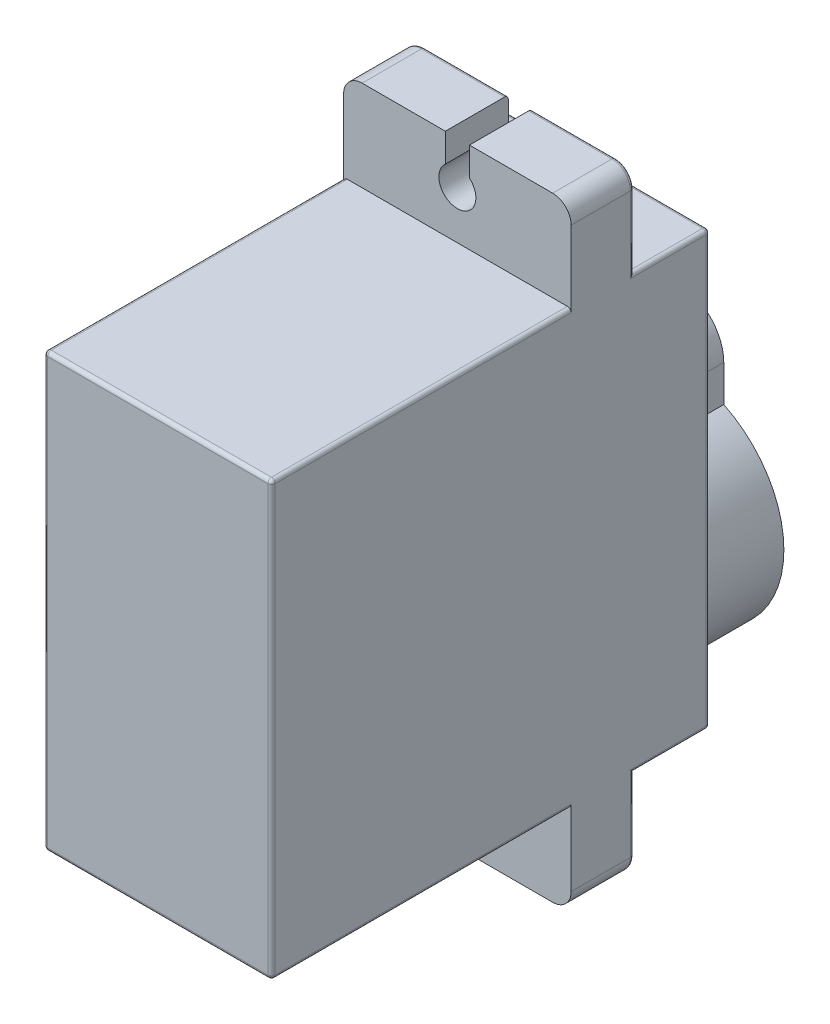
from build123d import *

# Parameters (mm, degrees)
DODANIE_WYCI_GNI_CIE1_DEPTH = 12.3
ZAOKR_GLENIE1_R             = 0.2
ZAOKR_GLENIE2_R             = 1
DODANIE_WYCI_GNI_CIE2_DEPTH = 4.4
SZKIC3_R                    = 2.45
WYTNIJ_WYCI_GNI_CIE1_DEPTH  = 3.2
WYTNIJ_WYCI_GNI_CIE2_REACH  = 38.556


with BuildPart() as part:
    # Szkic1 → Dodanie-wyciągnięcie1 (new body)
    with BuildSketch(Plane(origin=(0, 0, 0), x_dir=(0, 0, -1), z_dir=(1, 0, 0))):
        Polygon((0, 0), (0, 23.4), (16.2, 23.4), (16.2, 28.3), (19.6, 28.3), (19.6, 23.4), (23.7, 23.4), (23.7, 0), (19.6, 0), (19.6, -4.9), (16.2, -4.9), (16.2, 0), align=None)
    extrude(amount=DODANIE_WYCI_GNI_CIE1_DEPTH)

    # Zaokrąglenie1
    zaokr_glenie1_edges = [part.edges().sort_by_distance(p)[0] for p in [
        (0, 11.7, 0),
        (0, 23.4, -8.1),
        (0, 25.85, -19.6),
        (0, 23.4, -21.65),
        (0, 11.7, -23.7),
        (0, 0, -21.65),
        (0, -2.45, -19.6),
        (0, 0, -8.1),
        (12.3, -2.45, -19.6),
        (6.15, 0, 0),
        (6.15, 23.4, 0),
        (12.3, 0, -21.65),
        (6.15, 28.3, -19.6),
        (6.15, 23.4, -23.7),
        (6.15, 0, -23.7),
        (6.15, -4.9, -19.6),
        (12.3, 11.7, -23.7),
        (12.3, 23.4, -21.65),
        (12.3, 25.85, -19.6),
        (12.3, 23.4, -8.1),
        (12.3, 11.7, 0),
        (12.3, 0, -8.1),
    ]]
    fillet(zaokr_glenie1_edges, radius=ZAOKR_GLENIE1_R)

    # Zaokrąglenie2
    # the kernel refuses this fillet: 1 mm, written as the material it takes off along each edge
    with BuildSketch(Plane(origin=(11.3, 27.3, -19.6), x_dir=(0, 1, 0), z_dir=(-1, 0, 0))) as zaokr_glenie2_piece_1:
        with BuildLine():
            CenterArc((0.8, -0.2), 0.2, 0, 90)
            Line((1, -0.2), (1, 0))
            Line((1, 0), (0.8, 0))
        make_face()
    revolve(axis=Axis((11.3, 27.3, -19.6), (0, 0, -1)), revolution_arc=90, mode=Mode.SUBTRACT)
    with BuildSketch(Plane(origin=(1, 27.3, -19.6), x_dir=(-1, 0, 0), z_dir=(0, -1, 0))) as zaokr_glenie2_piece_2:
        with BuildLine():
            CenterArc((0.8, -0.2), 0.2, 0, 90)
            Line((1, -0.2), (1, 0))
            Line((1, 0), (0.8, 0))
        make_face()
    revolve(axis=Axis((1, 27.3, -19.6), (0, 0, -1)), revolution_arc=90, mode=Mode.SUBTRACT)
    with BuildSketch(Plane(origin=(11.3, -3.9, -19.6), x_dir=(1, 0, 0), z_dir=(0, 1, 0))) as zaokr_glenie2_piece_3:
        with BuildLine():
            CenterArc((0.8, -0.2), 0.2, 0, 90)
            Line((1, -0.2), (1, 0))
            Line((1, 0), (0.8, 0))
        make_face()
    revolve(axis=Axis((11.3, -3.9, -19.6), (0, 0, -1)), revolution_arc=90, mode=Mode.SUBTRACT)
    with BuildSketch(Plane(origin=(1, -3.9, -19.6), x_dir=(0, -1, 0), z_dir=(1, 0, 0))) as zaokr_glenie2_piece_4:
        with BuildLine():
            CenterArc((0.8, -0.2), 0.2, 0, 90)
            Line((1, -0.2), (1, 0))
            Line((1, 0), (0.8, 0))
        make_face()
    revolve(axis=Axis((1, -3.9, -19.6), (0, 0, -1)), revolution_arc=90, mode=Mode.SUBTRACT)
    with BuildSketch(Plane(origin=(12.3, -4.9, -19.6), x_dir=(-1, 0, 0), z_dir=(0, 0, 1)), Plane(origin=(0, -4.9, -19.6), x_dir=(0, 1, 0), z_dir=(0, 0, 1)), Plane(origin=(0, 28.3, -13.7), x_dir=(0, -1, 0), z_dir=(0, 0, -1)), Plane(origin=(12.3, 28.3, -13.7), x_dir=(-1, 0, 0), z_dir=(0, 0, -1))) as zaokr_glenie2_piece_5:
        with BuildLine():
            CenterArc((ZAOKR_GLENIE2_R, -ZAOKR_GLENIE2_R), ZAOKR_GLENIE2_R, 90, 90)
            Line((0, -ZAOKR_GLENIE2_R), (0, 0))
            Line((0, 0), (ZAOKR_GLENIE2_R, 0))
        make_face()
    extrude(amount=5.9, mode=Mode.SUBTRACT)

    # Szkic2 → Dodanie-wyciągnięcie2 (add)
    with BuildSketch(Plane(origin=(0, 0, -23.7), x_dir=(-1, 0, 0), z_dir=(0, 0, -1))):
        with BuildLine():
            Line((-3.65, 13.1), (-3.65, 11.128078794))
            ThreePointArc((-3.65, 11.128078794), (-6.15, 0.2), (-8.65, 11.128078794))
            Line((-8.65, 11.128078794), (-8.65, 13.1))
            ThreePointArc((-8.65, 13.1), (-6.15, 15.6), (-3.65, 13.1))
        make_face()
    extrude(amount=DODANIE_WYCI_GNI_CIE2_DEPTH)

    # Szkic3 → Wytnij-wyciągnięcie1 (cut)
    with BuildSketch(Plane(origin=(0, 0, -28.1), x_dir=(-1, 0, 0), z_dir=(0, 0, -1))):
        with Locations((-6.15, 5.95)):
            Circle(SZKIC3_R)
    extrude(amount=-WYTNIJ_WYCI_GNI_CIE1_DEPTH, mode=Mode.SUBTRACT)

    # Szkic5 → Wytnij-wyciągnięcie2 (cut, up to next)
    with BuildSketch(Plane(origin=(0, 0, -19.6), x_dir=(-1, 0, 0), z_dir=(0, 0, -1)), mode=Mode.PRIVATE) as wytnij_wyci_gni_cie2_sk1:
        with BuildLine():
            Line((-5.5, 26.759934208), (-5.5, 28.3))
            Line((-5.5, 28.3), (-6.8, 28.3))
            Line((-6.8, 28.3), (-6.8, 26.759934208))
            ThreePointArc((-6.8, 26.759934208), (-6.15, 25), (-5.5, 26.759934208))
        make_face()
    wytnij_wyci_gni_cie2_tool1 = extrude(wytnij_wyci_gni_cie2_sk1.sketch, amount=-WYTNIJ_WYCI_GNI_CIE2_REACH, mode=Mode.PRIVATE) & part.part
    wytnij_wyci_gni_cie2 = wytnij_wyci_gni_cie2_tool1.solids().sort_by_distance((6.15, 26.584181, -19.6))[0]
    add(wytnij_wyci_gni_cie2, mode=Mode.SUBTRACT)

    # Lustro1: Wytnij-wyciągnięcie2 across plane
    add(wytnij_wyci_gni_cie2.mirror(Plane.ZX.offset(11.7)), mode=Mode.SUBTRACT)


solid = part.part
